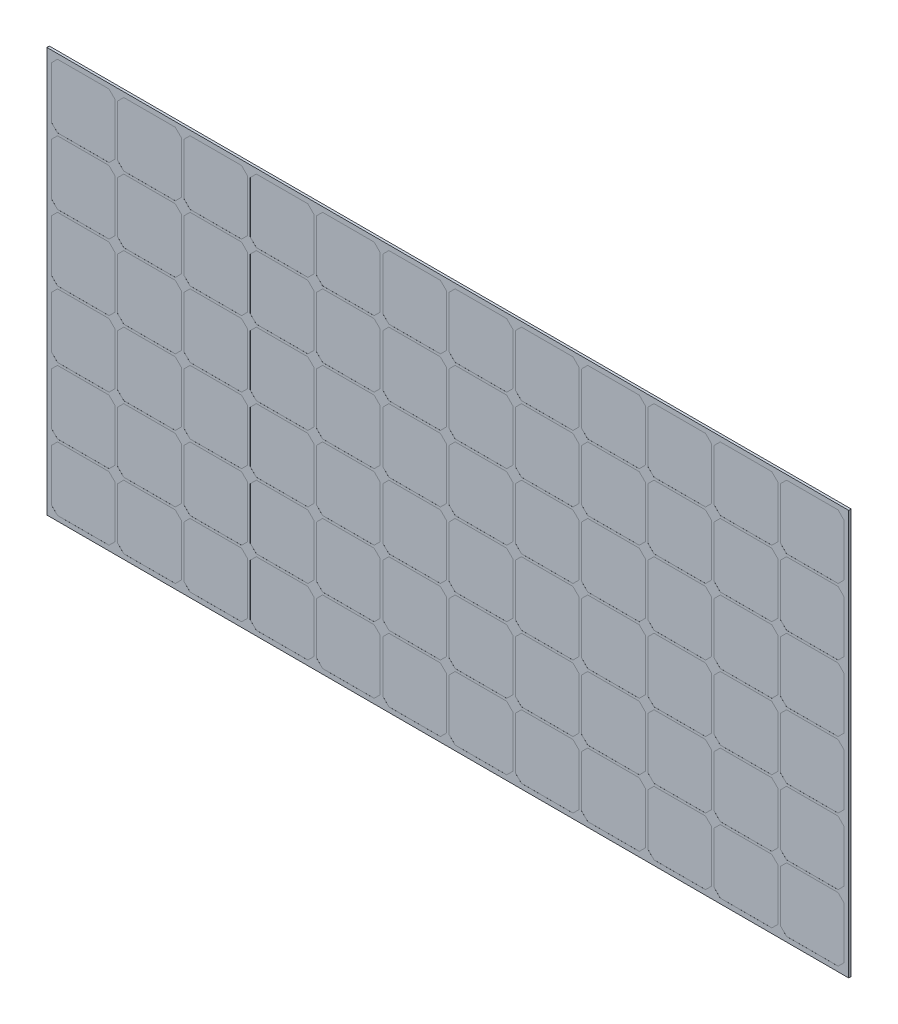
from build123d import *

# Parameters (mm, degrees)
CROQUIS1_W              = 1972
CROQUIS1_H              = 996
SALIENTE_EXTRUIR1_DEPTH = 6
CORTAR_EXTRUIR1_DEPTH   = 0.1


with BuildPart() as part:
    # Croquis1 → Saliente-Extruir1 (new body)
    with BuildSketch(Plane.XY):
        with Locations((986, 498)):
            Rectangle(CROQUIS1_W, CROQUIS1_H)
    extrude(amount=SALIENTE_EXTRUIR1_DEPTH)

    # Croquis2 → Cortar-Extruir1 (cut)
    with BuildSketch(Plane(origin=(0, 0, 0), x_dir=(-1, 0, 0), z_dir=(0, 0, -1))):
        Polygon((-1819.125, 983.875), (-1945.875, 983.875), (-1960.875, 968.875), (-1960.875, 842.125), (-1945.875, 827.125), (-1819.125, 827.125), (-1804.125, 842.125), (-1804.125, 968.875), align=None)
        Polygon((-1641.125, 968.875), (-1641.125, 842.125), (-1656.125, 827.125), (-1782.875, 827.125), (-1797.875, 842.125), (-1797.875, 968.875), (-1782.875, 983.875), (-1656.125, 983.875), align=None)
        Polygon((-1478.125, 968.875), (-1478.125, 842.125), (-1493.125, 827.125), (-1619.875, 827.125), (-1634.875, 842.125), (-1634.875, 968.875), (-1619.875, 983.875), (-1493.125, 983.875), align=None)
        Polygon((-1315.125, 968.875), (-1315.125, 842.125), (-1330.125, 827.125), (-1456.875, 827.125), (-1471.875, 842.125), (-1471.875, 968.875), (-1456.875, 983.875), (-1330.125, 983.875), align=None)
        Polygon((-1152.125, 968.875), (-1152.125, 842.125), (-1167.125, 827.125), (-1293.875, 827.125), (-1308.875, 842.125), (-1308.875, 968.875), (-1293.875, 983.875), (-1167.125, 983.875), align=None)
        Polygon((-989.125, 968.875), (-989.125, 842.125), (-1004.125, 827.125), (-1130.875, 827.125), (-1145.875, 842.125), (-1145.875, 968.875), (-1130.875, 983.875), (-1004.125, 983.875), align=None)
        Polygon((-826.125, 968.875), (-826.125, 842.125), (-841.125, 827.125), (-967.875, 827.125), (-982.875, 842.125), (-982.875, 968.875), (-967.875, 983.875), (-841.125, 983.875), align=None)
        Polygon((-663.125, 968.875), (-663.125, 842.125), (-678.125, 827.125), (-804.875, 827.125), (-819.875, 842.125), (-819.875, 968.875), (-804.875, 983.875), (-678.125, 983.875), align=None)
        Polygon((-500.125, 968.875), (-500.125, 842.125), (-515.125, 827.125), (-641.875, 827.125), (-656.875, 842.125), (-656.875, 968.875), (-641.875, 983.875), (-515.125, 983.875), align=None)
        Polygon((-337.125, 968.875), (-337.125, 842.125), (-352.125, 827.125), (-478.875, 827.125), (-493.875, 842.125), (-493.875, 968.875), (-478.875, 983.875), (-352.125, 983.875), align=None)
        Polygon((-174.125, 968.875), (-174.125, 842.125), (-189.125, 827.125), (-315.875, 827.125), (-330.875, 842.125), (-330.875, 968.875), (-315.875, 983.875), (-189.125, 983.875), align=None)
        Polygon((-11.125, 968.875), (-11.125, 842.125), (-26.125, 827.125), (-152.875, 827.125), (-167.875, 842.125), (-167.875, 968.875), (-152.875, 983.875), (-26.125, 983.875), align=None)
        Polygon((-1641.125, 805.875), (-1641.125, 679.125), (-1656.125, 664.125), (-1782.875, 664.125), (-1797.875, 679.125), (-1797.875, 805.875), (-1782.875, 820.875), (-1656.125, 820.875), align=None)
        Polygon((-1478.125, 805.875), (-1478.125, 679.125), (-1493.125, 664.125), (-1619.875, 664.125), (-1634.875, 679.125), (-1634.875, 805.875), (-1619.875, 820.875), (-1493.125, 820.875), align=None)
        Polygon((-1315.125, 805.875), (-1315.125, 679.125), (-1330.125, 664.125), (-1456.875, 664.125), (-1471.875, 679.125), (-1471.875, 805.875), (-1456.875, 820.875), (-1330.125, 820.875), align=None)
        Polygon((-1152.125, 805.875), (-1152.125, 679.125), (-1167.125, 664.125), (-1293.875, 664.125), (-1308.875, 679.125), (-1308.875, 805.875), (-1293.875, 820.875), (-1167.125, 820.875), align=None)
        Polygon((-989.125, 805.875), (-989.125, 679.125), (-1004.125, 664.125), (-1130.875, 664.125), (-1145.875, 679.125), (-1145.875, 805.875), (-1130.875, 820.875), (-1004.125, 820.875), align=None)
        Polygon((-826.125, 805.875), (-826.125, 679.125), (-841.125, 664.125), (-967.875, 664.125), (-982.875, 679.125), (-982.875, 805.875), (-967.875, 820.875), (-841.125, 820.875), align=None)
        Polygon((-663.125, 805.875), (-663.125, 679.125), (-678.125, 664.125), (-804.875, 664.125), (-819.875, 679.125), (-819.875, 805.875), (-804.875, 820.875), (-678.125, 820.875), align=None)
        Polygon((-500.125, 805.875), (-500.125, 679.125), (-515.125, 664.125), (-641.875, 664.125), (-656.875, 679.125), (-656.875, 805.875), (-641.875, 820.875), (-515.125, 820.875), align=None)
        Polygon((-337.125, 805.875), (-337.125, 679.125), (-352.125, 664.125), (-478.875, 664.125), (-493.875, 679.125), (-493.875, 805.875), (-478.875, 820.875), (-352.125, 820.875), align=None)
        Polygon((-174.125, 805.875), (-174.125, 679.125), (-189.125, 664.125), (-315.875, 664.125), (-330.875, 679.125), (-330.875, 805.875), (-315.875, 820.875), (-189.125, 820.875), align=None)
        Polygon((-11.125, 805.875), (-11.125, 679.125), (-26.125, 664.125), (-152.875, 664.125), (-167.875, 679.125), (-167.875, 805.875), (-152.875, 820.875), (-26.125, 820.875), align=None)
        Polygon((-1641.125, 642.875), (-1641.125, 516.125), (-1656.125, 501.125), (-1782.875, 501.125), (-1797.875, 516.125), (-1797.875, 642.875), (-1782.875, 657.875), (-1656.125, 657.875), align=None)
        Polygon((-1478.125, 642.875), (-1478.125, 516.125), (-1493.125, 501.125), (-1619.875, 501.125), (-1634.875, 516.125), (-1634.875, 642.875), (-1619.875, 657.875), (-1493.125, 657.875), align=None)
        Polygon((-1315.125, 642.875), (-1315.125, 516.125), (-1330.125, 501.125), (-1456.875, 501.125), (-1471.875, 516.125), (-1471.875, 642.875), (-1456.875, 657.875), (-1330.125, 657.875), align=None)
        Polygon((-1152.125, 642.875), (-1152.125, 516.125), (-1167.125, 501.125), (-1293.875, 501.125), (-1308.875, 516.125), (-1308.875, 642.875), (-1293.875, 657.875), (-1167.125, 657.875), align=None)
        Polygon((-989.125, 642.875), (-989.125, 516.125), (-1004.125, 501.125), (-1130.875, 501.125), (-1145.875, 516.125), (-1145.875, 642.875), (-1130.875, 657.875), (-1004.125, 657.875), align=None)
        Polygon((-826.125, 642.875), (-826.125, 516.125), (-841.125, 501.125), (-967.875, 501.125), (-982.875, 516.125), (-982.875, 642.875), (-967.875, 657.875), (-841.125, 657.875), align=None)
        Polygon((-663.125, 642.875), (-663.125, 516.125), (-678.125, 501.125), (-804.875, 501.125), (-819.875, 516.125), (-819.875, 642.875), (-804.875, 657.875), (-678.125, 657.875), align=None)
        Polygon((-500.125, 642.875), (-500.125, 516.125), (-515.125, 501.125), (-641.875, 501.125), (-656.875, 516.125), (-656.875, 642.875), (-641.875, 657.875), (-515.125, 657.875), align=None)
        Polygon((-337.125, 642.875), (-337.125, 516.125), (-352.125, 501.125), (-478.875, 501.125), (-493.875, 516.125), (-493.875, 642.875), (-478.875, 657.875), (-352.125, 657.875), align=None)
        Polygon((-174.125, 642.875), (-174.125, 516.125), (-189.125, 501.125), (-315.875, 501.125), (-330.875, 516.125), (-330.875, 642.875), (-315.875, 657.875), (-189.125, 657.875), align=None)
        Polygon((-11.125, 642.875), (-11.125, 516.125), (-26.125, 501.125), (-152.875, 501.125), (-167.875, 516.125), (-167.875, 642.875), (-152.875, 657.875), (-26.125, 657.875), align=None)
        Polygon((-1641.125, 479.875), (-1641.125, 353.125), (-1656.125, 338.125), (-1782.875, 338.125), (-1797.875, 353.125), (-1797.875, 479.875), (-1782.875, 494.875), (-1656.125, 494.875), align=None)
        Polygon((-1478.125, 479.875), (-1478.125, 353.125), (-1493.125, 338.125), (-1619.875, 338.125), (-1634.875, 353.125), (-1634.875, 479.875), (-1619.875, 494.875), (-1493.125, 494.875), align=None)
        Polygon((-1315.125, 479.875), (-1315.125, 353.125), (-1330.125, 338.125), (-1456.875, 338.125), (-1471.875, 353.125), (-1471.875, 479.875), (-1456.875, 494.875), (-1330.125, 494.875), align=None)
        Polygon((-1152.125, 479.875), (-1152.125, 353.125), (-1167.125, 338.125), (-1293.875, 338.125), (-1308.875, 353.125), (-1308.875, 479.875), (-1293.875, 494.875), (-1167.125, 494.875), align=None)
        Polygon((-989.125, 479.875), (-989.125, 353.125), (-1004.125, 338.125), (-1130.875, 338.125), (-1145.875, 353.125), (-1145.875, 479.875), (-1130.875, 494.875), (-1004.125, 494.875), align=None)
        Polygon((-826.125, 479.875), (-826.125, 353.125), (-841.125, 338.125), (-967.875, 338.125), (-982.875, 353.125), (-982.875, 479.875), (-967.875, 494.875), (-841.125, 494.875), align=None)
        Polygon((-663.125, 479.875), (-663.125, 353.125), (-678.125, 338.125), (-804.875, 338.125), (-819.875, 353.125), (-819.875, 479.875), (-804.875, 494.875), (-678.125, 494.875), align=None)
        Polygon((-500.125, 479.875), (-500.125, 353.125), (-515.125, 338.125), (-641.875, 338.125), (-656.875, 353.125), (-656.875, 479.875), (-641.875, 494.875), (-515.125, 494.875), align=None)
        Polygon((-337.125, 479.875), (-337.125, 353.125), (-352.125, 338.125), (-478.875, 338.125), (-493.875, 353.125), (-493.875, 479.875), (-478.875, 494.875), (-352.125, 494.875), align=None)
        Polygon((-174.125, 479.875), (-174.125, 353.125), (-189.125, 338.125), (-315.875, 338.125), (-330.875, 353.125), (-330.875, 479.875), (-315.875, 494.875), (-189.125, 494.875), align=None)
        Polygon((-11.125, 479.875), (-11.125, 353.125), (-26.125, 338.125), (-152.875, 338.125), (-167.875, 353.125), (-167.875, 479.875), (-152.875, 494.875), (-26.125, 494.875), align=None)
        Polygon((-1641.125, 316.875), (-1641.125, 190.125), (-1656.125, 175.125), (-1782.875, 175.125), (-1797.875, 190.125), (-1797.875, 316.875), (-1782.875, 331.875), (-1656.125, 331.875), align=None)
        Polygon((-1478.125, 316.875), (-1478.125, 190.125), (-1493.125, 175.125), (-1619.875, 175.125), (-1634.875, 190.125), (-1634.875, 316.875), (-1619.875, 331.875), (-1493.125, 331.875), align=None)
        Polygon((-1315.125, 316.875), (-1315.125, 190.125), (-1330.125, 175.125), (-1456.875, 175.125), (-1471.875, 190.125), (-1471.875, 316.875), (-1456.875, 331.875), (-1330.125, 331.875), align=None)
        Polygon((-1152.125, 316.875), (-1152.125, 190.125), (-1167.125, 175.125), (-1293.875, 175.125), (-1308.875, 190.125), (-1308.875, 316.875), (-1293.875, 331.875), (-1167.125, 331.875), align=None)
        Polygon((-989.125, 316.875), (-989.125, 190.125), (-1004.125, 175.125), (-1130.875, 175.125), (-1145.875, 190.125), (-1145.875, 316.875), (-1130.875, 331.875), (-1004.125, 331.875), align=None)
        Polygon((-826.125, 316.875), (-826.125, 190.125), (-841.125, 175.125), (-967.875, 175.125), (-982.875, 190.125), (-982.875, 316.875), (-967.875, 331.875), (-841.125, 331.875), align=None)
        Polygon((-663.125, 316.875), (-663.125, 190.125), (-678.125, 175.125), (-804.875, 175.125), (-819.875, 190.125), (-819.875, 316.875), (-804.875, 331.875), (-678.125, 331.875), align=None)
        Polygon((-500.125, 316.875), (-500.125, 190.125), (-515.125, 175.125), (-641.875, 175.125), (-656.875, 190.125), (-656.875, 316.875), (-641.875, 331.875), (-515.125, 331.875), align=None)
        Polygon((-337.125, 316.875), (-337.125, 190.125), (-352.125, 175.125), (-478.875, 175.125), (-493.875, 190.125), (-493.875, 316.875), (-478.875, 331.875), (-352.125, 331.875), align=None)
        Polygon((-174.125, 316.875), (-174.125, 190.125), (-189.125, 175.125), (-315.875, 175.125), (-330.875, 190.125), (-330.875, 316.875), (-315.875, 331.875), (-189.125, 331.875), align=None)
        Polygon((-11.125, 316.875), (-11.125, 190.125), (-26.125, 175.125), (-152.875, 175.125), (-167.875, 190.125), (-167.875, 316.875), (-152.875, 331.875), (-26.125, 331.875), align=None)
        Polygon((-1641.125, 153.875), (-1641.125, 27.125), (-1656.125, 12.125), (-1782.875, 12.125), (-1797.875, 27.125), (-1797.875, 153.875), (-1782.875, 168.875), (-1656.125, 168.875), align=None)
        Polygon((-1478.125, 153.875), (-1478.125, 27.125), (-1493.125, 12.125), (-1619.875, 12.125), (-1634.875, 27.125), (-1634.875, 153.875), (-1619.875, 168.875), (-1493.125, 168.875), align=None)
        Polygon((-1315.125, 153.875), (-1315.125, 27.125), (-1330.125, 12.125), (-1456.875, 12.125), (-1471.875, 27.125), (-1471.875, 153.875), (-1456.875, 168.875), (-1330.125, 168.875), align=None)
        Polygon((-1152.125, 153.875), (-1152.125, 27.125), (-1167.125, 12.125), (-1293.875, 12.125), (-1308.875, 27.125), (-1308.875, 153.875), (-1293.875, 168.875), (-1167.125, 168.875), align=None)
        Polygon((-989.125, 153.875), (-989.125, 27.125), (-1004.125, 12.125), (-1130.875, 12.125), (-1145.875, 27.125), (-1145.875, 153.875), (-1130.875, 168.875), (-1004.125, 168.875), align=None)
        Polygon((-826.125, 153.875), (-826.125, 27.125), (-841.125, 12.125), (-967.875, 12.125), (-982.875, 27.125), (-982.875, 153.875), (-967.875, 168.875), (-841.125, 168.875), align=None)
        Polygon((-663.125, 153.875), (-663.125, 27.125), (-678.125, 12.125), (-804.875, 12.125), (-819.875, 27.125), (-819.875, 153.875), (-804.875, 168.875), (-678.125, 168.875), align=None)
        Polygon((-500.125, 153.875), (-500.125, 27.125), (-515.125, 12.125), (-641.875, 12.125), (-656.875, 27.125), (-656.875, 153.875), (-641.875, 168.875), (-515.125, 168.875), align=None)
        Polygon((-337.125, 153.875), (-337.125, 27.125), (-352.125, 12.125), (-478.875, 12.125), (-493.875, 27.125), (-493.875, 153.875), (-478.875, 168.875), (-352.125, 168.875), align=None)
        Polygon((-174.125, 153.875), (-174.125, 27.125), (-189.125, 12.125), (-315.875, 12.125), (-330.875, 27.125), (-330.875, 153.875), (-315.875, 168.875), (-189.125, 168.875), align=None)
        Polygon((-11.125, 153.875), (-11.125, 27.125), (-26.125, 12.125), (-152.875, 12.125), (-167.875, 27.125), (-167.875, 153.875), (-152.875, 168.875), (-26.125, 168.875), align=None)
        Polygon((-1804.125, 805.875), (-1804.125, 679.125), (-1819.125, 664.125), (-1945.875, 664.125), (-1960.875, 679.125), (-1960.875, 805.875), (-1945.875, 820.875), (-1819.125, 820.875), align=None)
        Polygon((-1804.125, 642.875), (-1804.125, 516.125), (-1819.125, 501.125), (-1945.875, 501.125), (-1960.875, 516.125), (-1960.875, 642.875), (-1945.875, 657.875), (-1819.125, 657.875), align=None)
        Polygon((-1804.125, 479.875), (-1804.125, 353.125), (-1819.125, 338.125), (-1945.875, 338.125), (-1960.875, 353.125), (-1960.875, 479.875), (-1945.875, 494.875), (-1819.125, 494.875), align=None)
        Polygon((-1804.125, 316.875), (-1804.125, 190.125), (-1819.125, 175.125), (-1945.875, 175.125), (-1960.875, 190.125), (-1960.875, 316.875), (-1945.875, 331.875), (-1819.125, 331.875), align=None)
        Polygon((-1804.125, 153.875), (-1804.125, 27.125), (-1819.125, 12.125), (-1945.875, 12.125), (-1960.875, 27.125), (-1960.875, 153.875), (-1945.875, 168.875), (-1819.125, 168.875), align=None)
    cortar_extruir1 = extrude(amount=-CORTAR_EXTRUIR1_DEPTH, mode=Mode.SUBTRACT)

    # Simetría1: Cortar-Extruir1 across plane
    add(cortar_extruir1.mirror(Plane(origin=(0, 0, 3), x_dir=(1, 0, 0), z_dir=(0, 0, -1))), mode=Mode.SUBTRACT)


solid = part.part
